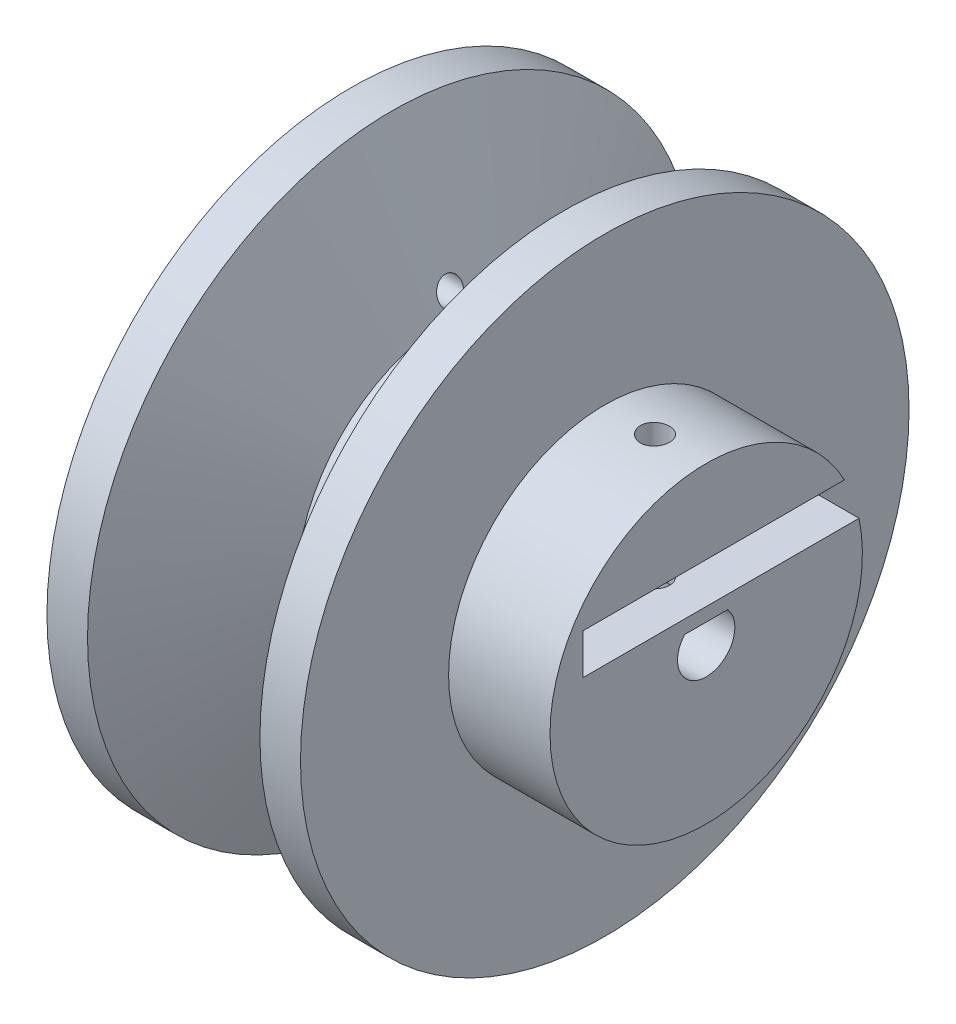
from build123d import *

# Parameters (mm, degrees)
SKETCH_3_R                = 2.825
CUT_EXTRUDE_2_DEPTH       = 35
SKETCH_14_R               = 1.25
CUT_EXTRUDE_5_DEPTH       = 12
SKETCH_16_W               = 5.008881277
SKETCH_16_H               = 1
EXTRUDE_2_DEPTH           = 30
SKETCH_19_W               = 0.959066555
SKETCH_19_H               = 0.511502163
EXTRUDE_3_DEPTH           = 30
SKETCH_24_W               = 27.218976977
SKETCH_24_H               = 4
CUT_EXTRUDE_8_DEPTH       = 9
SKETCH_25_R               = 1.43
CUT_EXTRUDE_9_DEPTH       = 22
EXTRUDE_4_DEPTH           = 3
EXTRUDE_4_DEPTH_BACK      = 3
CUT_EXTRUDE_12_DEPTH      = 3
CUT_EXTRUDE_12_DEPTH_BACK = 3


with BuildPart() as part:
    # 草圖1 → 旋轉1 (revolve)
    with BuildSketch(Plane.XY, mode=Mode.PRIVATE) as revolve_1_sk:
        Polygon((0, 0), (0, 30), (4, 30), (10, 15.4), (15, 15.4), (21, 30), (25, 30), (25, 15.4), (35, 15.4), (35, 0), align=None)
    revolve(revolve_1_sk.sketch.rotate(Axis((-743.15639781, 0, 0), (1, 0, 0)), 90), axis=Axis((-743.15639781, 0, 0), (1, 0, 0)))

    # 草圖3 → 除料-伸長2 (cut)
    with BuildSketch(Plane(origin=(35, 0, 0), x_dir=(0, 0, -1), z_dir=(1, 0, 0))):
        Circle(SKETCH_3_R)
    extrude(amount=-CUT_EXTRUDE_2_DEPTH, mode=Mode.SUBTRACT)

    # 草圖14 → 除料-伸長5 (cut)
    with BuildSketch(Plane.ZY):
        with Locations((-0.435299539, 17.00388826)):
            Circle(SKETCH_14_R)
    extrude(amount=-CUT_EXTRUDE_5_DEPTH, mode=Mode.SUBTRACT)

    # 草圖16 → 填料-伸長2 (add)
    with BuildSketch(Plane(origin=(35, 0, 0), x_dir=(0, 0, -1), z_dir=(1, 0, 0))):
        with Locations((-0.105543204, 2.350977924)):
            Rectangle(SKETCH_16_W, SKETCH_16_H)
    extrude(amount=-EXTRUDE_2_DEPTH)

    # 草圖19 → 填料-伸長3 (add)
    with BuildSketch(Plane(origin=(35, 0, 0), x_dir=(0, 0, -1), z_dir=(1, 0, 0))):
        with Locations((-0.084116996, 2.673942601)):
            Rectangle(SKETCH_19_W, SKETCH_19_H)
    extrude(amount=-EXTRUDE_3_DEPTH)

    # 草圖24 → 除料-伸長8 (cut)
    with BuildSketch(Plane(origin=(35, 0, 0), x_dir=(0, 0, -1), z_dir=(1, 0, 0))):
        with Locations((1.458428344, 5.180861889)):
            Rectangle(SKETCH_24_W, SKETCH_24_H)
    extrude(amount=-CUT_EXTRUDE_8_DEPTH, mode=Mode.SUBTRACT)

    # 草圖25 → 除料-伸長9 (cut)
    with BuildSketch(Plane(origin=(0, 22, 0), x_dir=(1, 0, 0), z_dir=(0, 1, 0))):
        with Locations(Location((29.956679037, 0, 0), (0, 0, 90))):
            Circle(SKETCH_25_R)
    extrude(amount=-CUT_EXTRUDE_9_DEPTH, mode=Mode.SUBTRACT)

    # 草圖35 → 伸長-薄件4 (add, two sides: drawn at the far end of the back side and taken through both)
    with BuildSketch(Plane.XY.offset(-EXTRUDE_4_DEPTH_BACK)):
        Polygon((17.369423388, -14.9), (7.630576612, -14.9), (12.5, -17.050888526), align=None)
        Polygon((15, -15.4), (10, -15.4), (12.5, -16.504282968), align=None, mode=Mode.SUBTRACT)
    extrude(amount=EXTRUDE_4_DEPTH + EXTRUDE_4_DEPTH_BACK)

    # 草圖36 → 除料-伸長12 (cut, two sides: drawn at the far end of the back side and taken through both)
    with BuildSketch(Plane.XY.offset(-CUT_EXTRUDE_12_DEPTH_BACK)):
        Polygon((11.902920357, -16.787150573), (13.343105155, -16.787150573), (13.343105155, -17.362903865), (11.859661783, -17.362903865), align=None)
    extrude(amount=CUT_EXTRUDE_12_DEPTH + CUT_EXTRUDE_12_DEPTH_BACK, mode=Mode.SUBTRACT)

    # 圓角14
    # a fillet whose section is not a circle: 0.5 mm, written as the material it takes off along each edge
    with BuildSketch(Plane(origin=(11.902920357, -16.787150573, -3.263777256), x_dir=(-0.9147364009889508, 0.4040511313012026, 0), z_dir=(0, 0, 1))) as fillet_14_piece_1:
        with BuildLine():
            add(Edge.make_bspline([(0.105510902, 0), (0.085856889, 0), (0.066202875, 0), (0.022459615, -0.001857581), (-0.01979407, -0.01077403), (-0.060558179, -0.026749346), (-0.078536421, -0.034690573), (-0.096514663, -0.0426318)], knots=[0, 0, 0, 0, 0, 0, 0.5, 0.5, 1, 1, 1, 1, 1, 1], degree=5))
            Line((-0.096514663, -0.0426318), (0, 0))
            Line((0, 0), (0.105510902, 0))
        make_face()
    extrude(amount=6.527554512, mode=Mode.SUBTRACT)
    with BuildSketch(Plane(origin=(13.097079643, -16.787150573, 3.263777256), x_dir=(-1, 0, 0), z_dir=(0, 0, -1))) as fillet_14_piece_2:
        with BuildLine():
            add(Edge.make_bspline([(0.105510902, 0), (0.085856889, 0), (0.066202875, 0), (0.022459615, 0.001857581), (-0.01979407, 0.01077403), (-0.060558179, 0.026749346), (-0.078536421, 0.034690573), (-0.096514663, 0.0426318)], knots=[0, 0, 0, 0, 0, 0, 0.5, 0.5, 1, 1, 1, 1, 1, 1], degree=5))
            Line((-0.096514663, 0.0426318), (0, 0))
            Line((0, 0), (0.105510902, 0))
        make_face()
    extrude(amount=6.527554512, mode=Mode.SUBTRACT)


solid = part.part
